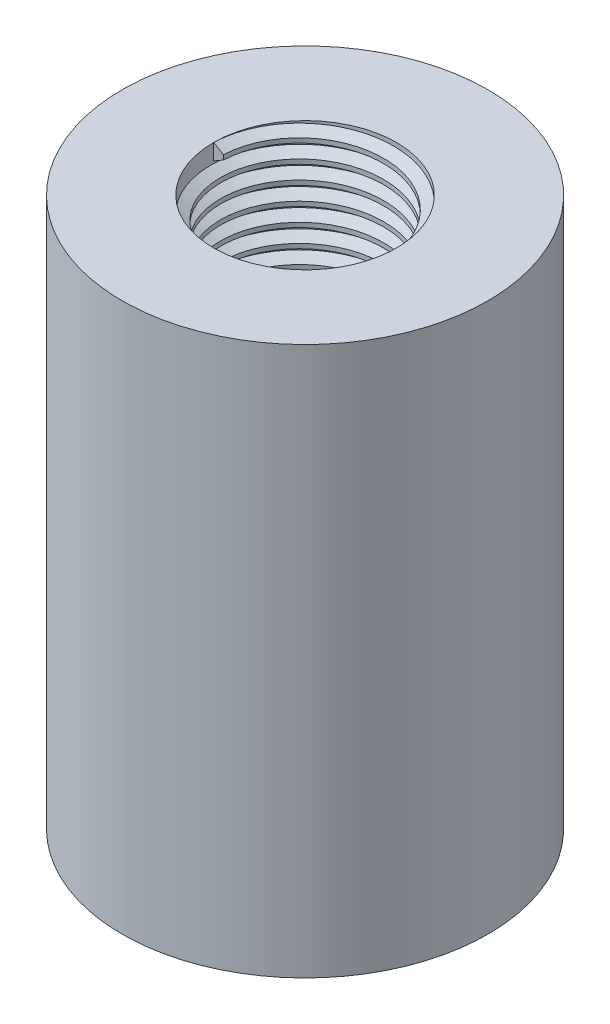
from build123d import *

# Parameters (mm, degrees)
SKETCH1_R           = 12.7
SKETCH1_R_2         = 6.35
BOSS_EXTRUDE1_DEPTH = 38.1
THREAD1_PITCH       = 1.27


with BuildPart() as part:
    # Sketch1 → Boss-Extrude1 (new body)
    with BuildSketch(Plane(origin=(0, 0, 0), x_dir=(1, 0, 0), z_dir=(0, 1, 0))):
        with Locations(Location((0, 0, 0), (0, 0, 90))):
            Circle(SKETCH1_R)
        with Locations(Location((0, 0, 0), (0, 0, 90))):
            Circle(SKETCH1_R_2, mode=Mode.SUBTRACT)
    extrude(amount=BOSS_EXTRUDE1_DEPTH)

    # Thread1: the profile of Thread Profile1 profile screwed along a right-hand helix of 30 turns, 8 arcs to a turn; built about Z, then put on its axis
    thread1_z = Axis((0, 0, 0), (0, 0, 1))
    thread1_corners = [(6.3503, 0, -0.000173205), (6.3503, 0, 1.111423202), (5.662592339, 0, 0.714374998), (5.662592339, 0, 0.396874998)]
    with BuildLine(mode=Mode.PRIVATE) as thread1_profile:
        Line(thread1_corners[0], thread1_corners[1])
        Line(thread1_corners[1], thread1_corners[2])
        Line(thread1_corners[2], thread1_corners[3])
        Line(thread1_corners[3], thread1_corners[0])
    thread1_cap = Face(thread1_profile.wire())
    thread1_turn_angles = [0, 22.5, 45, 67.5, 90, 112.5, 135, 157.5, 180, 202.5, 225, 247.5, 270, 292.5, 315, 337.5, 360]
    thread1_turn_weights = [1, 0.9238795325112867, 1, 0.9238795325112867, 1, 0.9238795325112867, 1, 0.9238795325112867, 1, 0.9238795325112867, 1, 0.9238795325112867, 1, 0.9238795325112867, 1, 0.9238795325112867, 1]
    thread1_turn_rails = [Edge.make_bspline([Vector(p[0], p[1], 0).rotate(thread1_z, thread1_turn_angles[k]) / thread1_turn_weights[k] + Vector(0, 0, p[2] + THREAD1_PITCH * thread1_turn_angles[k] / 360) for k in range(17)], [0, 0, 0, 1, 1, 2, 2, 3, 3, 4, 4, 5, 5, 6, 6, 7, 7, 8, 8, 8], 2, thread1_turn_weights) for p in thread1_corners]
    thread1_turn_sides = [Face.make_surface_from_curves(thread1_turn_rails[p[0]], thread1_turn_rails[p[1]]) for p in [(0, 1), (1, 2), (2, 3), (3, 0)]]
    thread1 = Plane(origin=(0, 38.1, 0), x_dir=(-1, 0, 0), z_dir=(0, -1, 0)) * Solid(Shell([*[p.moved(Location((0, 0, THREAD1_PITCH * i))) for i in range(30) for p in thread1_turn_sides], thread1_cap, thread1_cap.rotate(thread1_z, 10800).moved(Location((0, 0, THREAD1_PITCH * 10800 / 360)))]))
    add(thread1)


solid = part.part
